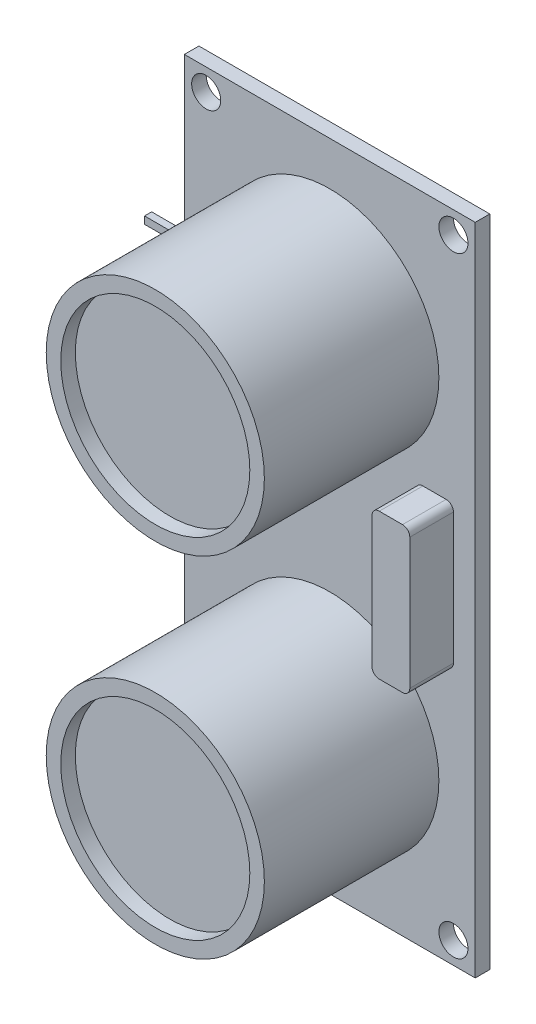
from build123d import *

# Parameters (mm, degrees)
SKETCH1_W           = 20
SKETCH1_H           = 45
BOSS_EXTRUDE1_DEPTH = 1
SKETCH2_R           = 7.5
BOSS_EXTRUDE2_DEPTH = 12
SKETCH3_R           = 6.5
CUT_EXTRUDE1_DEPTH  = 1
SKETCH4_W           = 2.6
SKETCH4_H           = 10
BOSS_EXTRUDE3_DEPTH = 3
FILLET1_R           = 0.5
SKETCH5_W           = 3
SKETCH5_H           = 15
BOSS_EXTRUDE4_DEPTH = 3
SKETCH6_W           = 0.5
SKETCH6_H           = 0.5
BOSS_EXTRUDE5_DEPTH = 3
SKETCH7_W           = 0.490041207
SKETCH7_H           = 0.5
BOSS_EXTRUDE6_DEPTH = 12
SKETCH8_R           = 1
CUT_EXTRUDE2_DEPTH  = 3


with BuildPart() as part:
    # Sketch1 → Boss-Extrude1 (new body)
    with BuildSketch(Plane.XY):
        with Locations((-12.292244857, -79.882705913)):
            Rectangle(SKETCH1_W, SKETCH1_H)
    extrude(amount=BOSS_EXTRUDE1_DEPTH)

    # Sketch2 → Boss-Extrude2 (add)
    with BuildSketch(Plane.XY.offset(1)):
        with Locations((-12.292244857, -67.882705913)):
            Circle(SKETCH2_R)
        with Locations((-12.292244857, -91.882705913)):
            Circle(SKETCH2_R)
    extrude(amount=BOSS_EXTRUDE2_DEPTH)

    # Sketch3 → Cut-Extrude1 (cut)
    with BuildSketch(Plane.XY.offset(13)):
        with Locations((-12.292244857, -67.882705913)):
            Circle(SKETCH3_R)
        with Locations((-12.292244857, -91.882705913)):
            Circle(SKETCH3_R)
    extrude(amount=-CUT_EXTRUDE1_DEPTH, mode=Mode.SUBTRACT)

    # Sketch4 → Boss-Extrude3 (add)
    with BuildSketch(Plane.XY.offset(1)):
        with Locations((-5.092244857, -79.882705913)):
            Rectangle(SKETCH4_W, SKETCH4_H)
    extrude(amount=BOSS_EXTRUDE3_DEPTH)

    # Fillet1
    fillet1_edges = [part.edges().sort_by_distance(p)[0] for p in [
        (-6.392244857, -74.882705913, 2.5),
        (-3.792244857, -74.882705913, 2.5),
        (-6.392244857, -84.882705913, 2.5),
        (-3.792244857, -84.882705913, 2.5),
    ]]
    fillet(fillet1_edges, radius=FILLET1_R)

    # Sketch5 → Boss-Extrude4 (add)
    with BuildSketch(Plane(origin=(0, 0, 0), x_dir=(-1, 0, 0), z_dir=(0, 0, -1))):
        with Locations((19.292244857, -79.882705913)):
            Rectangle(SKETCH5_W, SKETCH5_H)
    extrude(amount=BOSS_EXTRUDE4_DEPTH)

    # Sketch6 → Boss-Extrude5 (add)
    with BuildSketch(Plane(origin=(0, 0, -3), x_dir=(-1, 0, 0), z_dir=(0, 0, -1))):
        with Locations((19.292244857, -84.632705913)):
            Rectangle(SKETCH6_W, SKETCH6_H)
        with Locations((19.292244857, -81.632705913)):
            Rectangle(SKETCH6_W, SKETCH6_H)
        with Locations((19.292244857, -78.132705913)):
            Rectangle(SKETCH6_W, SKETCH6_H)
        with Locations((19.292244857, -75.132705913)):
            Rectangle(SKETCH6_W, SKETCH6_H)
    extrude(amount=BOSS_EXTRUDE5_DEPTH)

    # Sketch7 → Boss-Extrude6 (add)
    with BuildSketch(Plane.ZY.offset(19.542244857)):
        with Locations((-5.754979396, -75.132705913)):
            Rectangle(SKETCH7_W, SKETCH7_H)
        with Locations((-5.754979396, -78.132705913)):
            Rectangle(SKETCH7_W, SKETCH7_H)
        with Locations((-5.754979396, -81.632705913)):
            Rectangle(SKETCH7_W, SKETCH7_H)
        with Locations((-5.754979396, -84.632705913)):
            Rectangle(SKETCH7_W, SKETCH7_H)
    extrude(amount=BOSS_EXTRUDE6_DEPTH)

    # Sketch8 → Cut-Extrude2 (cut)
    with BuildSketch(Plane.XY.offset(1)):
        with Locations((-20.792244857, -58.882705913)):
            Circle(SKETCH8_R)
        with Locations((-3.792244857, -58.882705913)):
            Circle(SKETCH8_R)
        with Locations((-3.792244857, -100.882705913)):
            Circle(SKETCH8_R)
        with Locations((-20.792244857, -100.882705913)):
            Circle(SKETCH8_R)
    extrude(amount=-CUT_EXTRUDE2_DEPTH, mode=Mode.SUBTRACT)


solid = part.part
